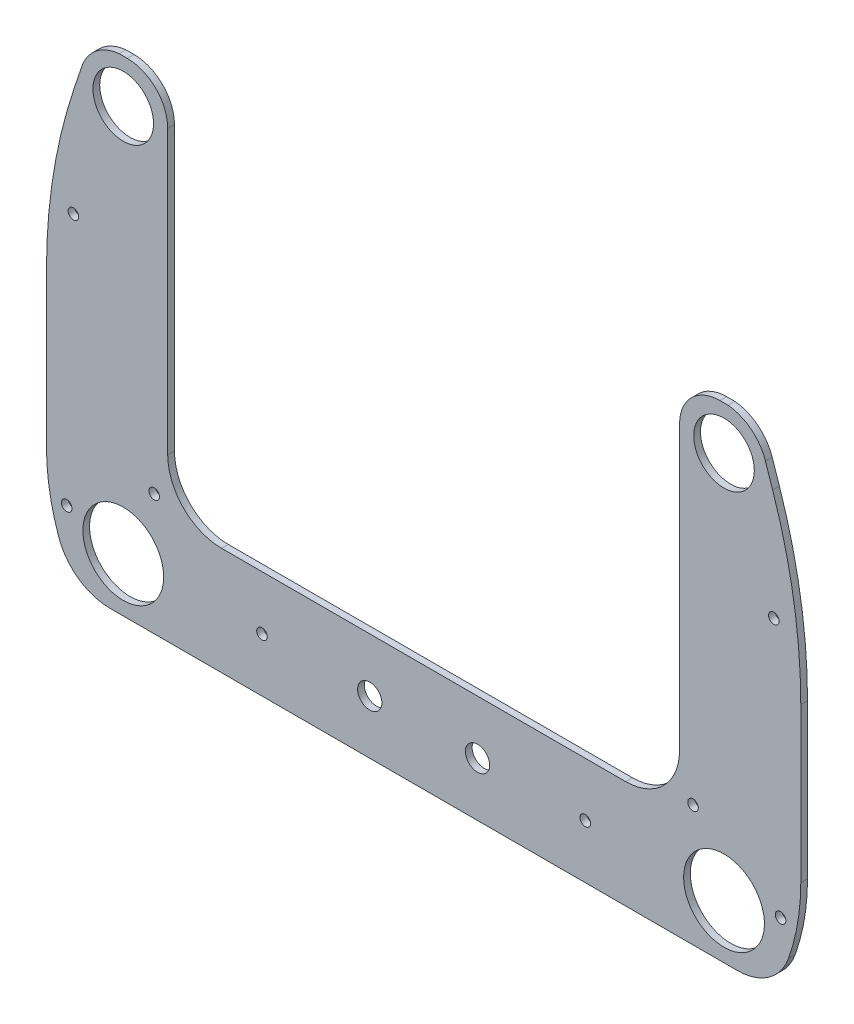
from build123d import *

# Parameters (mm, degrees)
SKETCH1_R           = 14.2875
SKETCH1_R_2         = 19.05
SKETCH1_R_3         = 2.4892
SKETCH1_R_4         = 5.715
BOSS_EXTRUDE3_DEPTH = 3.175
SKETCH2_W           = 355.6
SKETCH2_H           = 19.05
CUT_EXTRUDE1_DEPTH  = 290.621961572
FILLET1_R           = 19.05
CUT_EXTRUDE2_DEPTH  = 290.621961572
FILLET2_R           = 254
CUT_EXTRUDE3_DEPTH  = 290.621961572
FILLET3_R           = 25.4


with BuildPart() as part:
    # Sketch1 → Boss-Extrude3 (new body)
    with BuildSketch(Plane.XY):
        with BuildLine():
            Line((120.65, -152.4), (120.65, -6.35))
            Line((120.65, -6.35), (120.65, 6.35))
            ThreePointArc((120.65, 6.35), (124.369743879, 15.330256121), (133.35, 19.05))
            Line((133.35, 19.05), (165.1, 19.05))
            ThreePointArc((165.1, 19.05), (174.080256121, 15.330256121), (177.8, 6.35))
            Line((177.8, 6.35), (177.8, -6.35))
            Line((177.8, -6.35), (177.8, -222.25))
            ThreePointArc((177.8, -222.25), (175.940128061, -226.740128061), (171.45, -228.6))
            Line((171.45, -228.6), (12.7, -228.6))
            Line((12.7, -228.6), (-12.7, -228.6))
            Line((-12.7, -228.6), (-171.45, -228.6))
            ThreePointArc((-171.45, -228.6), (-175.940128061, -226.740128061), (-177.8, -222.25))
            Line((-177.8, -222.25), (-177.8, -6.35))
            Line((-177.8, -6.35), (-177.8, 6.35))
            ThreePointArc((-177.8, 6.35), (-174.080256121, 15.330256121), (-165.1, 19.05))
            Line((-165.1, 19.05), (-133.35, 19.05))
            ThreePointArc((-133.35, 19.05), (-124.369743879, 15.330256121), (-120.65, 6.35))
            Line((-120.65, 6.35), (-120.65, -6.35))
            Line((-120.65, -6.35), (-120.65, -152.4))
            ThreePointArc((-120.65, -152.4), (-113.210512242, -170.360512242), (-95.25, -177.8))
            Line((-95.25, -177.8), (-12.7, -177.8))
            Line((-12.7, -177.8), (12.7, -177.8))
            Line((12.7, -177.8), (95.25, -177.8))
            ThreePointArc((95.25, -177.8), (113.210512242, -170.360512242), (120.65, -152.4))
        make_face()
        with Locations((141.605, -20.50288)):
            Circle(SKETCH1_R, mode=Mode.SUBTRACT)
        with Locations((-141.605, -20.50288)):
            Circle(SKETCH1_R, mode=Mode.SUBTRACT)
        with Locations((-141.605, -203.2)):
            Circle(SKETCH1_R_2, mode=Mode.SUBTRACT)
        with Locations((141.605, -203.2)):
            Circle(SKETCH1_R_2, mode=Mode.SUBTRACT)
        with Locations((-76.2, -203.2)):
            Circle(SKETCH1_R_3, mode=Mode.SUBTRACT)
        with Locations((76.2, -203.2)):
            Circle(SKETCH1_R_3, mode=Mode.SUBTRACT)
        with Locations((-25.4, -203.2)):
            Circle(SKETCH1_R_4, mode=Mode.SUBTRACT)
        with Locations((-149.225, 6.35)):
            Circle(SKETCH1_R_3, mode=Mode.SUBTRACT)
        with Locations((149.225, 6.35)):
            Circle(SKETCH1_R_3, mode=Mode.SUBTRACT)
        with Locations((-168.275, -196.85)):
            Circle(SKETCH1_R_3, mode=Mode.SUBTRACT)
        with Locations((168.275, -196.85)):
            Circle(SKETCH1_R_3, mode=Mode.SUBTRACT)
        with Locations((-165.1, -76.2)):
            Circle(SKETCH1_R_3, mode=Mode.SUBTRACT)
        with Locations((165.1, -76.2)):
            Circle(SKETCH1_R_3, mode=Mode.SUBTRACT)
        with Locations((-127, -171.45)):
            Circle(SKETCH1_R_3, mode=Mode.SUBTRACT)
        with Locations((127, -171.45)):
            Circle(SKETCH1_R_3, mode=Mode.SUBTRACT)
        with Locations((25.4, -203.2)):
            Circle(SKETCH1_R_4, mode=Mode.SUBTRACT)
    extrude(amount=BOSS_EXTRUDE3_DEPTH)

    # Sketch2 → Cut-Extrude1 (cut, through all)
    with BuildSketch(Plane.XY.offset(3.175)):
        with Locations((0, 9.525)):
            Rectangle(SKETCH2_W, SKETCH2_H)
    extrude(amount=-CUT_EXTRUDE1_DEPTH, mode=Mode.SUBTRACT)

    # Fillet1
    fillet1_edges = [part.edges().sort_by_distance(p)[0] for p in [
        (177.8, 0, 1.5875),
        (120.65, 0, 1.5875),
        (-120.65, 0, 1.5875),
        (-177.8, 0, 1.5875),
    ]]
    fillet(fillet1_edges, radius=FILLET1_R)

    # Sketch3 → Cut-Extrude2 (cut, through all)
    with BuildSketch(Plane.XY.offset(3.175)):
        with BuildLine():
            Line((-177.8, -63.5), (-161.120810729, -13.935517906))
            ThreePointArc((-161.120810729, -13.935517906), (-154.382419454, -4.355599567), (-143.51, 0))
            Line((-143.51, 0), (-177.8, 0))
            Line((-177.8, 0), (-177.8, -63.5))
        make_face()
    cut_extrude2 = extrude(amount=-CUT_EXTRUDE2_DEPTH, mode=Mode.SUBTRACT)

    # Mirror1: Cut-Extrude2 across plane
    add(cut_extrude2.mirror(Plane.ZY), mode=Mode.SUBTRACT)

    # Fillet2
    fillet2_edges = [part.edges().sort_by_distance(p)[0] for p in [
        (177.8, -63.5, 1.5875),
        (-177.8, -63.5, 1.5875),
    ]]
    fillet(fillet2_edges, radius=FILLET2_R)

    # Sketch4 → Cut-Extrude3 (cut, through all)
    with BuildSketch(Plane.XY.offset(3.175)):
        with BuildLine():
            Line((-177.8, -177.8), (-177.8, -228.6))
            Line((-177.8, -228.6), (-164.188181024, -228.6))
            ThreePointArc((-164.188181024, -228.6), (-174.338063951, -204.096014982), (-177.8, -177.8))
        make_face()
        with BuildLine():
            Line((177.8, -177.8), (177.8, -228.6))
            Line((177.8, -228.6), (164.188181024, -228.6))
            ThreePointArc((164.188181024, -228.6), (174.338063951, -204.096014982), (177.8, -177.8))
        make_face()
    extrude(amount=-CUT_EXTRUDE3_DEPTH, mode=Mode.SUBTRACT)

    # Fillet3
    fillet3_edges = [part.edges().sort_by_distance(p)[0] for p in [
        (164.188181024, -228.6, 1.5875),
        (-164.188181024, -228.6, 1.5875),
    ]]
    fillet(fillet3_edges, radius=FILLET3_R)


solid = part.part
